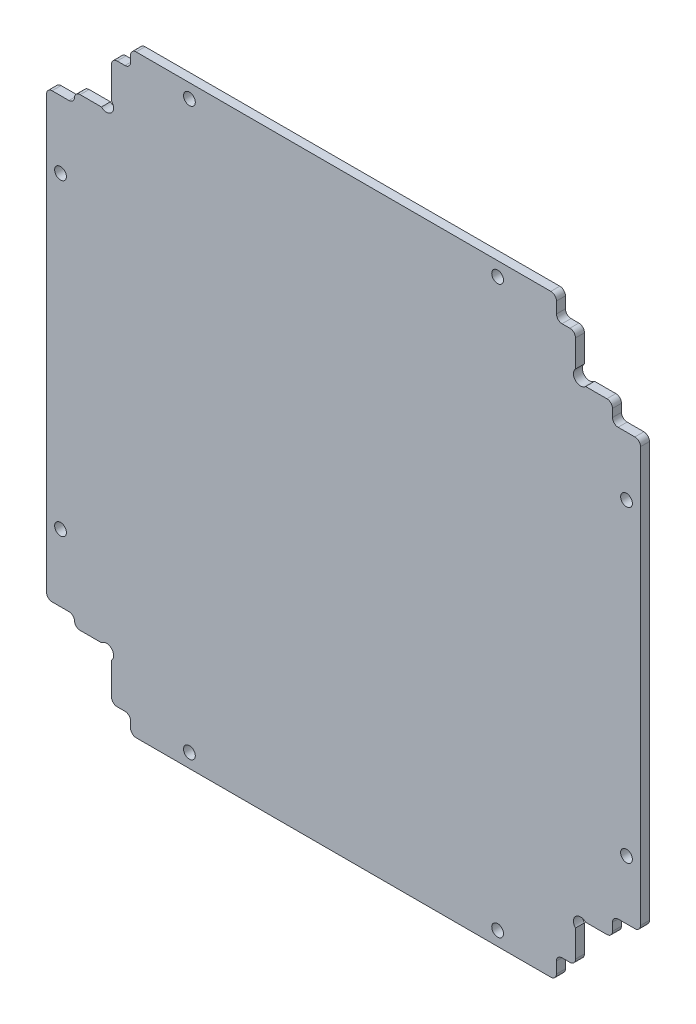
from build123d import *

# Parameters (mm, degrees)
SKETCH1_W            = 106
SKETCH1_H            = 106
MAINOUTLINE_DEPTH    = 1.6
RAILCUTOUTS_DEPTH    = 75.970394157
DOGBONES_DEPTH       = 75.970394157
SOLARFILLETS_DEPTH   = 75.970394157
HANDLINGFILLETS_R    = 1
M2_CLEARANCE_HOLE1_D = 2.1


with BuildPart() as part:
    # Sketch1 → mainOutline (new body)
    with BuildSketch(Plane.XY):
        Rectangle(SKETCH1_W, SKETCH1_H)
    extrude(amount=MAINOUTLINE_DEPTH)

    # Sketch4 → railCutouts (cut, through all)
    with BuildSketch(Plane(origin=(0, 0, 0), x_dir=(-1, 0, 0), z_dir=(0, 0, -1))):
        Polygon((-41.4, -41.4), (-48, -41.4), (-48, -39), (-49.9975, -39), (-60.106513243, -39), (-60.106513243, -61.452099286), (-39, -61.452099286), (-39, -49.9), (-39, -49), (-41.4, -49), align=None)
        Polygon((39, -56.27525328), (39, -49.9), (41.4, -49.9), (41.4, -41.4), (48, -41.4), (48, -40.5), (55.517672261, -40.5), (55.517672261, -56.27525328), align=None)
        Polygon((55.383846757, 40.5), (48, 40.5), (48, 41.4), (41.4, 41.4), (41.4, 49.9), (39, 49.9), (39, 57.687687567), (55.383846757, 57.687687567), align=None)
        Polygon((-39, 59.880423019), (-39, 49.9), (-39, 49), (-41.4, 49), (-41.4, 41.4), (-48, 41.4), (-48, 39), (-49.9975, 39), (-56.842822937, 39), (-56.842822937, 59.880423019), align=None)
    extrude(amount=-RAILCUTOUTS_DEPTH, mode=Mode.SUBTRACT)

    # Sketch5 → dogbones (cut, through all)
    with BuildSketch(Plane(origin=(0, 0, 0), x_dir=(-1, 0, 0), z_dir=(0, 0, -1))):
        with BuildLine():
            Line((-41.4, -43.196051224), (-44.546497129, -46.342548353))
            ThreePointArc((-44.546497129, -46.342548353), (-46.342548353, -46.342548353), (-46.342548353, -44.546497129))
            Line((-46.342548353, -44.546497129), (-43.196051224, -41.4))
            ThreePointArc((-43.196051224, -41.4), (-41.4, -41.4), (-41.4, -43.196051224))
        make_face()
        with BuildLine():
            Line((43.196051224, -41.4), (44.93821772, -43.142166495))
            ThreePointArc((44.93821772, -43.142166495), (44.93821772, -44.93821772), (43.142166495, -44.93821772))
            Line((43.142166495, -44.93821772), (41.4, -43.196051224))
            ThreePointArc((41.4, -43.196051224), (41.4, -41.4), (43.196051224, -41.4))
        make_face()
        with BuildLine():
            Line((41.4, 43.196051224), (43.13099025, 44.927041474))
            ThreePointArc((43.13099025, 44.927041474), (44.927041474, 44.927041474), (44.927041474, 43.13099025))
            Line((44.927041474, 43.13099025), (43.196051224, 41.4))
            ThreePointArc((43.196051224, 41.4), (41.4, 41.4), (41.4, 43.196051224))
        make_face()
        with BuildLine():
            Line((-43.196051224, 41.4), (-44.694846249, 42.898795025))
            ThreePointArc((-44.694846249, 42.898795025), (-44.694846249, 44.694846249), (-42.898795025, 44.694846249))
            Line((-42.898795025, 44.694846249), (-41.4, 43.196051224))
            ThreePointArc((-41.4, 43.196051224), (-41.4, 41.4), (-43.196051224, 41.4))
        make_face()
    extrude(amount=-DOGBONES_DEPTH, mode=Mode.SUBTRACT)

    # Sketch6 → solarFillets (cut, through all)
    with BuildSketch(Plane(origin=(0, 0, 0), x_dir=(-1, 0, 0), z_dir=(0, 0, -1))):
        with BuildLine():
            Line((-40, 50), (-40, 53))
            ThreePointArc((-40, 53), (-39, 54), (-38, 53))
            Line((-38, 53), (-38, 50))
            ThreePointArc((-38, 50), (-39, 49), (-40, 50))
        make_face()
        with BuildLine():
            Line((-49, 38), (-53, 38))
            ThreePointArc((-53, 38), (-54, 39), (-53, 40))
            Line((-53, 40), (-49, 40))
            ThreePointArc((-49, 40), (-48, 39), (-49, 38))
        make_face()
        with BuildLine():
            Line((-49, -40), (-55.214202913, -40))
            ThreePointArc((-55.214202913, -40), (-56.214202913, -39), (-55.214202913, -38))
            Line((-55.214202913, -38), (-49, -38))
            ThreePointArc((-49, -38), (-48, -39), (-49, -40))
        make_face()
        with BuildLine():
            Line((-38, -50), (-38, -53.916094318))
            ThreePointArc((-38, -53.916094318), (-39, -54.916094318), (-40, -53.916094318))
            Line((-40, -53.916094318), (-40, -50))
            ThreePointArc((-40, -50), (-39, -49), (-38, -50))
        make_face()
        with BuildLine():
            Line((40, -50.9), (40, -54.538013421))
            ThreePointArc((40, -54.538013421), (39, -55.538013421), (38, -54.538013421))
            Line((38, -54.538013421), (38, -50.9))
            ThreePointArc((38, -50.9), (39, -49.9), (40, -50.9))
        make_face()
        with BuildLine():
            Line((49, -39.5), (54.202622605, -39.5))
            ThreePointArc((54.202622605, -39.5), (55.202622605, -40.5), (54.202622605, -41.5))
            Line((54.202622605, -41.5), (49, -41.5))
            ThreePointArc((49, -41.5), (48, -40.5), (49, -39.5))
        make_face()
        with BuildLine():
            Line((49, 41.5), (54.556563772, 41.5))
            ThreePointArc((54.556563772, 41.5), (55.556563772, 40.5), (54.556563772, 39.5))
            Line((54.556563772, 39.5), (49, 39.5))
            ThreePointArc((49, 39.5), (48, 40.5), (49, 41.5))
        make_face()
        with BuildLine():
            Line((38, 50.9), (38, 55.828092709))
            ThreePointArc((38, 55.828092709), (39, 56.828092709), (40, 55.828092709))
            Line((40, 55.828092709), (40, 50.9))
            ThreePointArc((40, 50.9), (39, 49.9), (38, 50.9))
        make_face()
    extrude(amount=-SOLARFILLETS_DEPTH, mode=Mode.SUBTRACT)

    # handlingFillets
    handlingfillets_edges = [part.edges().sort_by_distance(p)[0] for p in [
        (-41.4, -49.9, 0.8),
        (-38, -53, 0.8),
        (-53, -39.5, 0.8),
        (-48, -41.4, 0.8),
        (-48, 41.4, 0.8),
        (-53, 39.5, 0.8),
        (-41.4, 49.9, 0.8),
        (-38, 53, 0.8),
        (38, 53, 0.8),
        (41.4, 49, 0.8),
        (48, 41.4, 0.8),
        (53, 38, 0.8),
        (53, -38, 0.8),
        (48, -41.4, 0.8),
        (41.4, -49, 0.8),
        (38, -53, 0.8),
    ]]
    fillet(handlingfillets_edges, radius=HANDLINGFILLETS_R)

    # M2 Clearance Hole1 (through all)
    with Locations(Plane(origin=(0, 0, 0), x_dir=(-1, 0, 0), z_dir=(0, 0, -1))):
        with Locations((50.5, -27.5), (27.5, -50.5), (-50.5, -27.5), (-27.5, -50.5), (-27.5, 50.5), (-50.5, 27.5), (27.5, 50.5), (50.5, 27.5)):
            Hole(M2_CLEARANCE_HOLE1_D / 2)


solid = part.part
